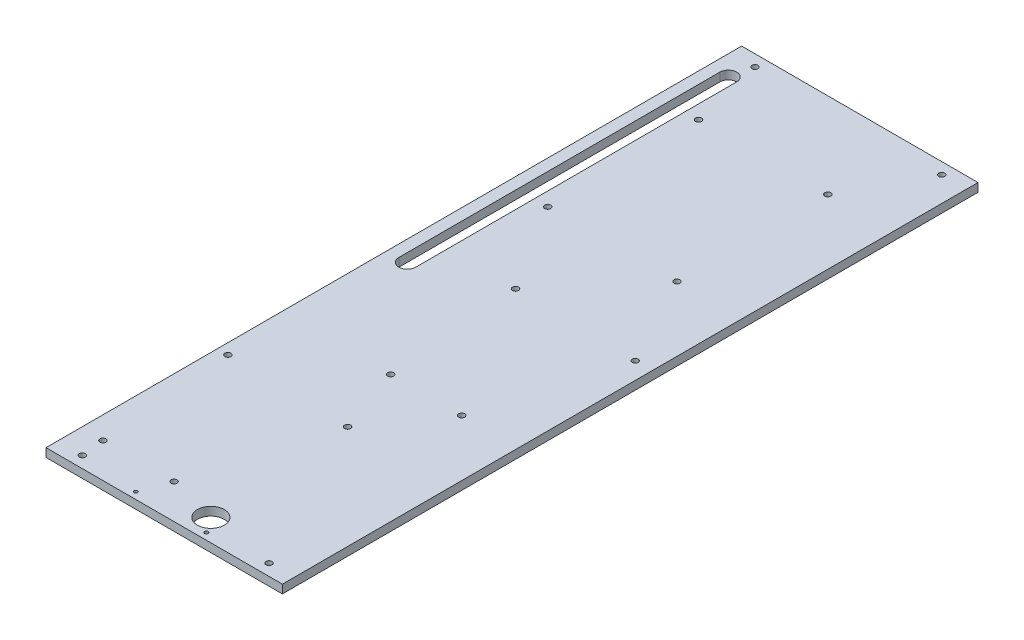
from build123d import *

# Parameters (mm, degrees)
SKETCH2_W           = 88.9
SKETCH2_H           = 3.2004
BOSS_EXTRUDE1_DEPTH = 261.62
SKETCH3_R           = 0.6731
SKETCH3_R_2         = 5.08
SKETCH3_R_3         = 1.1303
SKETCH3_R_4         = 1.130300001
CUT_EXTRUDE1_DEPTH  = 266.665663227


with BuildPart() as part:
    # Sketch2 → Boss-Extrude1 (new body)
    with BuildSketch(Plane.XY):
        with Locations((-1.625781684, -22.993244248)):
            Rectangle(SKETCH2_W, SKETCH2_H)
    extrude(amount=BOSS_EXTRUDE1_DEPTH)

    # Sketch3 → Cut-Extrude1 (cut, through all)
    with BuildSketch(Plane(origin=(0, -21.393044248, 0), x_dir=(-1, 0, 0), z_dir=(0, 1, 0))):
        with Locations((14.833781684, 259.08)):
            Circle(SKETCH3_R)
        with Locations((-11.683818316, 259.08)):
            Circle(SKETCH3_R)
        with Locations((-7.619818316, 253.318755316)):
            Circle(SKETCH3_R_2)
        with Locations((-33.478453416, 257.302)):
            Circle(SKETCH3_R_3)
        with Locations((36.730016784, 257.302)):
            Circle(SKETCH3_R_3)
        with Locations((-33.478453416, 4.318)):
            Circle(SKETCH3_R_3)
        with Locations((36.730016784, 4.318)):
            Circle(SKETCH3_R_3)
        with Locations((-18.450986138, 32.12110162)):
            Circle(SKETCH3_R_3)
        with Locations((-18.450986138, 88.83930162)):
            Circle(SKETCH3_R_3)
        with Locations((30.164613862, 88.83930162)):
            Circle(SKETCH3_R_3)
        with Locations((30.164613862, 32.12110162)):
            Circle(SKETCH3_R_3)
        with Locations((-21.61210834, 172.955592112)):
            Circle(SKETCH3_R_3)
        with Locations((-36.421379204, 122.504632562)):
            Circle(SKETCH3_R_3)
        with Locations((5.12700506, 172.955592112)):
            Circle(SKETCH3_R_3)
        with Locations((9.515898481, 121.588311164)):
            Circle(SKETCH3_R_3)
        with Locations((81.579081393, -113.266782514)):
            Circle(SKETCH3_R_3)
        with Locations((66.769810529, -163.717742064)):
            Circle(SKETCH3_R_3)
        with Locations((108.318194793, -113.266782514)):
            Circle(SKETCH3_R_3)
        with Locations((97.604440284, -108.476314785)):
            Circle(SKETCH3_R_3)
        with Locations((82.79516942, -158.927274335)):
            Circle(SKETCH3_R_3)
        with Locations((124.343553684, -108.476314785)):
            Circle(SKETCH3_R_3)
        with Locations((112.789811005, -158.927274335)):
            Circle(SKETCH3_R_3)
        with Locations((10.965129528, 248.56821)):
            Circle(SKETCH3_R_3)
        with Locations((-3.844141336, 198.11725045)):
            Circle(SKETCH3_R_3)
        with Locations((37.704242928, 248.56821)):
            Circle(SKETCH3_R_3)
        with Locations((42.093136349, 197.200929052)):
            Circle(SKETCH3_R_4)
        with BuildLine():
            Line((35.32929924, 12.595958552), (35.32929924, 133.302587666))
            ThreePointArc((35.32929924, 133.302587666), (38.50429924, 136.477587666), (41.67929924, 133.302587666))
            Line((41.67929924, 133.302587666), (41.67929924, 12.595958552))
            ThreePointArc((41.67929924, 12.595958552), (38.50429924, 9.420958552), (35.32929924, 12.595958552))
        make_face()
    extrude(amount=-CUT_EXTRUDE1_DEPTH, mode=Mode.SUBTRACT)


solid = part.part
